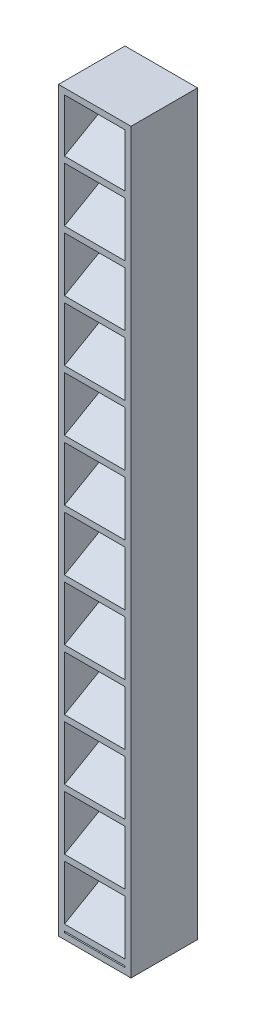
from build123d import *

# Parameters (mm, degrees)
ESBO_O1_W                = 12
ESBO_O1_H                = 122
RESSALTO_EXTRUS_O1_DEPTH = 1
ESBO_O2_W                = 12
ESBO_O2_H                = 122
ESBO_O2_W_2              = 10
ESBO_O2_H_2              = 120
RESSALTO_EXTRUS_O2_DEPTH = 10
ESBO_O3_W                = 10
ESBO_O3_H                = 1
RESSALTO_EXTRUS_O3_DEPTH = 11.547005384
PADR_O_START             = -5
PADR_O_LINEAR1_DEPTH     = 10


# Read off the part's stored shape, not the designer's step: Padrão linear1
with BuildPart() as part:
    # Esboço1 → Ressalto-extrusão1 (new body)
    with BuildSketch(Plane.XY):
        Rectangle(ESBO_O1_W, ESBO_O1_H)
    extrude(amount=RESSALTO_EXTRUS_O1_DEPTH)

    # Esboço2 → Ressalto-extrusão2 (add)
    with BuildSketch(Plane.XY.offset(1)):
        Rectangle(ESBO_O2_W, ESBO_O2_H)
        Rectangle(ESBO_O2_W_2, ESBO_O2_H_2, mode=Mode.SUBTRACT)
    extrude(amount=RESSALTO_EXTRUS_O2_DEPTH)

    # Esboço3 → Ressalto-extrusão3 (add, along a direction that is not the sketch's normal)
    with BuildSketch(Plane.XY.offset(1)):
        with Locations((0, 56.5)):
            Rectangle(ESBO_O3_W, ESBO_O3_H)
    extrude(amount=RESSALTO_EXTRUS_O3_DEPTH, dir=(0, -0.4999999999999981, 0.8660254037844398))

    # Padrão linear1 outline → Padrão linear1 (add)
    with BuildSketch(Plane.YZ.offset(PADR_O_START)):
        Polygon((-58.773502692, 11), (-59.773502692, 11), (-54, 1), (-53, 1), align=None)
        Polygon((-48.773502692, 11), (-49.773502692, 11), (-44, 1), (-43, 1), align=None)
        Polygon((-38.773502692, 11), (-39.773502692, 11), (-34, 1), (-33, 1), align=None)
        Polygon((-28.773502692, 11), (-29.773502692, 11), (-24, 1), (-23, 1), align=None)
        Polygon((-18.773502692, 11), (-19.773502692, 11), (-14, 1), (-13, 1), align=None)
        Polygon((-8.773502692, 11), (-9.773502692, 11), (-4, 1), (-3, 1), align=None)
        Polygon((1.226497308, 11), (0.226497308, 11), (6, 1), (7, 1), align=None)
        Polygon((11.226497308, 11), (10.226497308, 11), (16, 1), (17, 1), align=None)
        Polygon((21.226497308, 11), (20.226497308, 11), (26, 1), (27, 1), align=None)
        Polygon((31.226497308, 11), (30.226497308, 11), (36, 1), (37, 1), align=None)
        Polygon((41.226497308, 11), (40.226497308, 11), (46, 1), (47, 1), align=None)
    extrude(amount=PADR_O_LINEAR1_DEPTH)


solid = part.part
